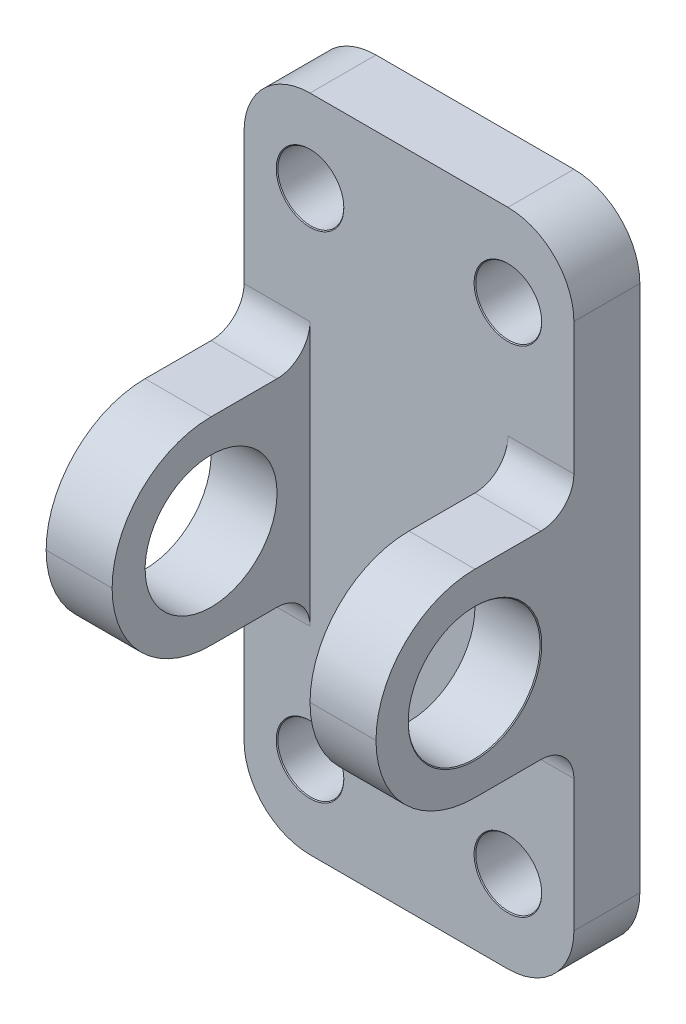
from build123d import *

# Parameters (mm, degrees)
SKETCH1_W                       = 20
SKETCH1_H                       = 10
BOSS_EXTRUDE1_DEPTH             = 2
SKETCH2_W                       = 6
SKETCH2_H                       = 2
BOSS_EXTRUDE2_DEPTH             = 6
FILLET1_R                       = 3
F_4_0MM_DOWEL_HOLE1_D           = 4
F_4_0MM_DOWEL_HOLE1_CSINK_D     = 4.05
F_4_0MM_DOWEL_HOLE1_CSINK_ANGLE = 90
F_2_0MM_DOWEL_HOLE1_D           = 2
F_2_0MM_DOWEL_HOLE1_CSINK_D     = 2.05
F_2_0MM_DOWEL_HOLE1_CSINK_ANGLE = 90
FILLET2_R                       = 1
FILLET3_R                       = 2


with BuildPart() as part:
    # Sketch1 → Boss-Extrude1 (new body)
    with BuildSketch(Plane(origin=(0, 0, 0), x_dir=(0, 1, 0), z_dir=(0, 0, 1))):
        Rectangle(SKETCH1_W, SKETCH1_H)
    extrude(amount=-BOSS_EXTRUDE1_DEPTH)

    # Sketch2 → Boss-Extrude2 (add)
    with BuildSketch(Plane(origin=(0, 0, 0), x_dir=(0, 1, 0), z_dir=(0, 0, 1))):
        with Locations((0, 4)):
            Rectangle(SKETCH2_W, SKETCH2_H)
        with Locations((0, -4)):
            Rectangle(SKETCH2_W, SKETCH2_H)
    extrude(amount=BOSS_EXTRUDE2_DEPTH)

    # Fillet1
    fillet1_edges = [part.edges().sort_by_distance(p)[0] for p in [
        (4, 3, 6),
        (4, -3, 6),
        (-4, 3, 6),
        (-4, -3, 6),
    ]]
    fillet(fillet1_edges, radius=FILLET1_R - 0.0001)  # a hair under: the kernel refuses the full size

    # Ø4.0mm Dowel Hole1 (through all)
    with Locations(Plane.YZ.offset(5)):
        with Locations((0, 3)):
            CounterSinkHole(F_4_0MM_DOWEL_HOLE1_D / 2, F_4_0MM_DOWEL_HOLE1_CSINK_D / 2, counter_sink_angle=F_4_0MM_DOWEL_HOLE1_CSINK_ANGLE)

    # Ø2.0mm Dowel Hole1 (through all)
    with Locations(Plane(origin=(0, 0, 0), x_dir=(0, 1, 0), z_dir=(0, 0, 1))):
        with Locations((7.5, -3), (-7.5, 3), (-7.5, -3), (7.5, 3)):
            CounterSinkHole(F_2_0MM_DOWEL_HOLE1_D / 2, F_2_0MM_DOWEL_HOLE1_CSINK_D / 2, counter_sink_angle=F_2_0MM_DOWEL_HOLE1_CSINK_ANGLE)

    # Fillet2
    fillet2_edges = [part.edges().sort_by_distance(p)[0] for p in [
        (-4, -3, 0),
        (-4, 3, 0),
        (4, -3, 0),
        (4, 3, 0),
    ]]
    fillet(fillet2_edges, radius=FILLET2_R)

    # Fillet3
    fillet3_edges = [part.edges().sort_by_distance(p)[0] for p in [
        (-5, -10, -1),
        (-5, 10, -1),
        (5, 10, -1),
        (5, -10, -1),
    ]]
    fillet(fillet3_edges, radius=FILLET3_R)


solid = part.part
